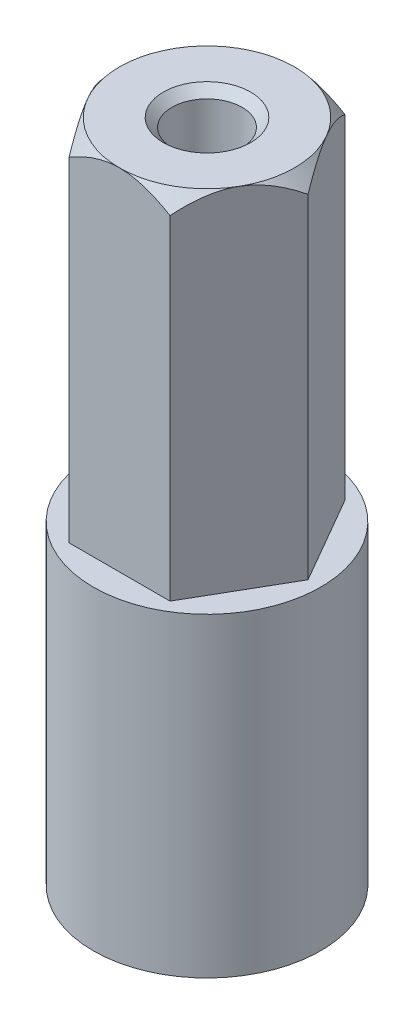
from build123d import *

# Parameters (mm, degrees)
SKETCH1_R                                         = 3.25
SKETCH1_R_2                                       = 1.5
BOSS_EXTRUDE1_DEPTH                               = 6
SKETCH2_R                                         = 3.25
BOSS_EXTRUDE2_DEPTH                               = 3
BOSS_EXTRUDE3_DEPTH                               = 10
SKETCH4_OUTSIDE_W                                 = 29.504
SKETCH4_OUTSIDE_H                                 = 29.504
SKETCH4_OUTSIDE_R                                 = 2.5
CUT_EXTRUDE1_DEPTH                                = 10
CUT_EXTRUDE1_DRAFT                                = -40
CSK_FOR_M2_5_FLAT_HEAD_MACHINE_SCREW1_D           = 2
CSK_FOR_M2_5_FLAT_HEAD_MACHINE_SCREW1_DEPTH       = 6
CSK_FOR_M2_5_FLAT_HEAD_MACHINE_SCREW1_CSINK_D     = 2.5
CSK_FOR_M2_5_FLAT_HEAD_MACHINE_SCREW1_CSINK_ANGLE = 90
CSK_FOR_M2_5_FLAT_HEAD_MACHINE_SCREW1_TIP         = 0.600860619
SKETCH8_R                                         = 1.5
CUT_EXTRUDE2_DEPTH                                = 20.548017802


with BuildPart() as part:
    # Sketch1 → Boss-Extrude1 (new body)
    with BuildSketch(Plane(origin=(0, 0, 0), x_dir=(1, 0, 0), z_dir=(0, 1, 0))):
        Circle(SKETCH1_R)
        Circle(SKETCH1_R_2, mode=Mode.SUBTRACT)
    extrude(amount=BOSS_EXTRUDE1_DEPTH)

    # Sketch2 → Boss-Extrude2 (add)
    with BuildSketch(Plane(origin=(0, 6, 0), x_dir=(1, 0, 0), z_dir=(0, 1, 0))):
        Circle(SKETCH2_R)
    extrude(amount=BOSS_EXTRUDE2_DEPTH)

    # Sketch3 → Boss-Extrude3 (add)
    with BuildSketch(Plane(origin=(0, 9, 0), x_dir=(1, 0, 0), z_dir=(0, 1, 0))):
        Polygon((2.886751346, 0), (1.443375673, 2.5), (-1.443375673, 2.5), (-2.886751346, 0), (-1.443375673, -2.5), (1.443375673, -2.5), align=None)
    extrude(amount=BOSS_EXTRUDE3_DEPTH)


with BuildPart() as cut_extrude1_tool:
    # Sketch4 outside → Cut-Extrude1 (with draft: the straight prism first)
    with BuildSketch(Plane(origin=(0, 19, 0), x_dir=(1, 0, 0), z_dir=(0, 1, 0))):
        Rectangle(SKETCH4_OUTSIDE_W, SKETCH4_OUTSIDE_H)
        Circle(SKETCH4_OUTSIDE_R, mode=Mode.SUBTRACT)
    extrude(amount=-CUT_EXTRUDE1_DEPTH)
    # Cut-Extrude1: the draft: its side faces are tilted about the plane it starts from
    cut_extrude1_sides = [cut_extrude1_tool.faces().sort_by_distance(p)[0] for p in [
        (0, 14, 14.752),
        (14.752, 14, 0),
        (0, 14, -14.752),
        (-14.752, 14, 0),
        (-2.5, 14, 0),
    ]]
    draft(cut_extrude1_sides, Plane(origin=(0, 19, 0), x_dir=(1, 0, 0), z_dir=(0, 1, 0)), CUT_EXTRUDE1_DRAFT)


with BuildPart() as part_1:
    add(part.part)

    # Cut-Extrude1: cut by cut_extrude1_tool
    add(cut_extrude1_tool.part, mode=Mode.SUBTRACT)

    # CSK for M2.5 Flat Head Machine Screw1
    with Locations(Plane(origin=(0, 19, 0), x_dir=(1, 0, 0), z_dir=(0, 1, 0))):
        with Locations((0, 0)):
            CounterSinkHole(CSK_FOR_M2_5_FLAT_HEAD_MACHINE_SCREW1_D / 2, CSK_FOR_M2_5_FLAT_HEAD_MACHINE_SCREW1_CSINK_D / 2, depth=CSK_FOR_M2_5_FLAT_HEAD_MACHINE_SCREW1_DEPTH, counter_sink_angle=CSK_FOR_M2_5_FLAT_HEAD_MACHINE_SCREW1_CSINK_ANGLE)
            with Locations((0, 0, -(CSK_FOR_M2_5_FLAT_HEAD_MACHINE_SCREW1_DEPTH + CSK_FOR_M2_5_FLAT_HEAD_MACHINE_SCREW1_TIP / 2))):  # 118° drill point
                Cone(0, CSK_FOR_M2_5_FLAT_HEAD_MACHINE_SCREW1_D / 2, CSK_FOR_M2_5_FLAT_HEAD_MACHINE_SCREW1_TIP, mode=Mode.SUBTRACT)

    # Sketch8 → Cut-Extrude2 (cut, through all)
    with BuildSketch(Plane(origin=(0, 0, 0), x_dir=(0, 0, -1), z_dir=(1, 0, 0))):
        with Locations((0, 4)):
            Circle(SKETCH8_R)
    extrude(amount=-CUT_EXTRUDE2_DEPTH, mode=Mode.SUBTRACT)


solid = part_1.part
